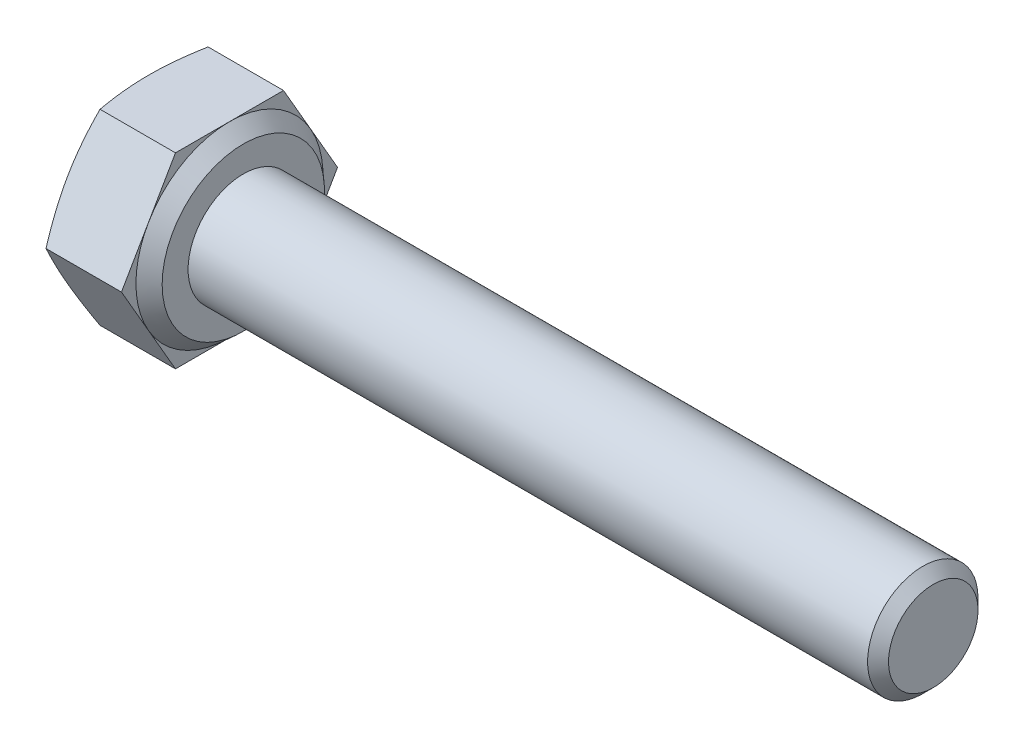
from build123d import *

# Parameters (mm, degrees)
BASEHEAD_DEPTH = 2.925
SKETCH3_R      = 2
BASEBODY_DEPTH = 25


with BuildPart() as part:
    # Sketch-BaseHead → BaseHead (new body)
    with BuildSketch(Plane(origin=(0, 0, 0), x_dir=(0, 0, -1), z_dir=(1, 0, 0))):
        Polygon((3.914434825, 0), (1.957217413, 3.39), (-1.957217413, 3.39), (-3.914434825, 0), (-1.957217413, -3.39), (1.957217413, -3.39), align=None)
    extrude(amount=BASEHEAD_DEPTH)

    # Sketch4 → HeadChamfer (revolve, cut)
    with BuildSketch(Plane(origin=(-0.264637255, 0, 5.916896391), x_dir=(0, 0, -1), z_dir=(0, 1, 0))):
        Polygon((9.831331216, -0.264637255), (9.306896391, -0.264637255), (9.831331216, -0.455515922), align=None)
    revolve(axis=Axis((-4.001564945, 0, 0), (1, 0, 0)), mode=Mode.SUBTRACT)

    # Sketch1 → Revolve1 (revolve)
    with BuildSketch(Plane.XY, mode=Mode.PRIVATE) as revolve1_sk:
        Polygon((2.925, 0), (3.425, 0), (3.425, -2.94), (2.925, -3.39), align=None)
    revolve(revolve1_sk.sketch.rotate(Axis((-4.001564945, 0, 0), (1, 0, 0)), 270), axis=Axis((-4.001564945, 0, 0), (1, 0, 0)))

    # Sketch3 → BaseBody (add)
    with BuildSketch(Plane(origin=(3.425, 0, 0), x_dir=(0, 0, -1), z_dir=(1, 0, 0))):
        Circle(SKETCH3_R)
    extrude(amount=BASEBODY_DEPTH)

    # Chamfer1: read off the stored shape, not the designer's step
    # Chamfer1 outline → Chamfer1 (revolve, cut)
    with BuildSketch(Plane.YX):
        Polygon((2, 28.425), (1.621, 28.425), (2, 28.046), align=None)
    revolve(axis=Axis((0, 0, 0), (1, 0, 0)), mode=Mode.SUBTRACT)


solid = part.part
